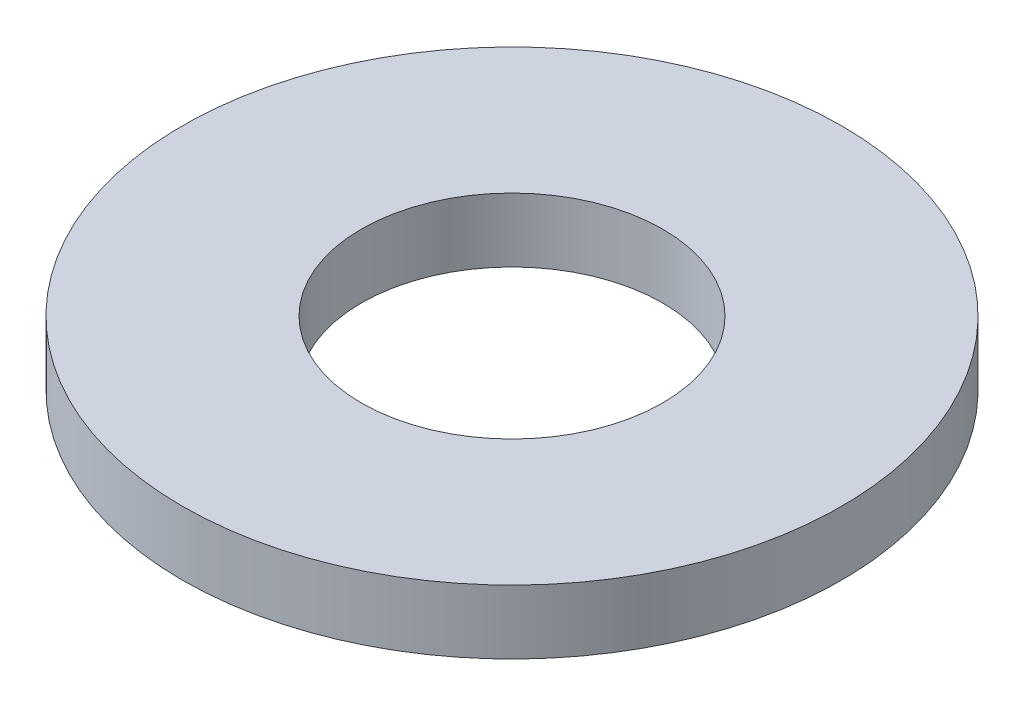
from build123d import *

# Parameters (mm, degrees)
SKETCH1_R           = 87.5
BOSS_EXTRUDE1_DEPTH = 17
SKETCH2_R           = 40
CUT_EXTRUDE1_DEPTH  = 125.905964629


with BuildPart() as part:
    # Sketch1 → Boss-Extrude1 (new body)
    with BuildSketch(Plane(origin=(0, 0, 0), x_dir=(1, 0, 0), z_dir=(0, 1, 0))):
        Circle(SKETCH1_R)
    extrude(amount=BOSS_EXTRUDE1_DEPTH)

    # Sketch2 → Cut-Extrude1 (cut, through all)
    with BuildSketch(Plane(origin=(0, 0, 0), x_dir=(1, 0, 0), z_dir=(0, 1, 0))):
        Circle(SKETCH2_R)
    extrude(amount=CUT_EXTRUDE1_DEPTH, mode=Mode.SUBTRACT)


solid = part.part
